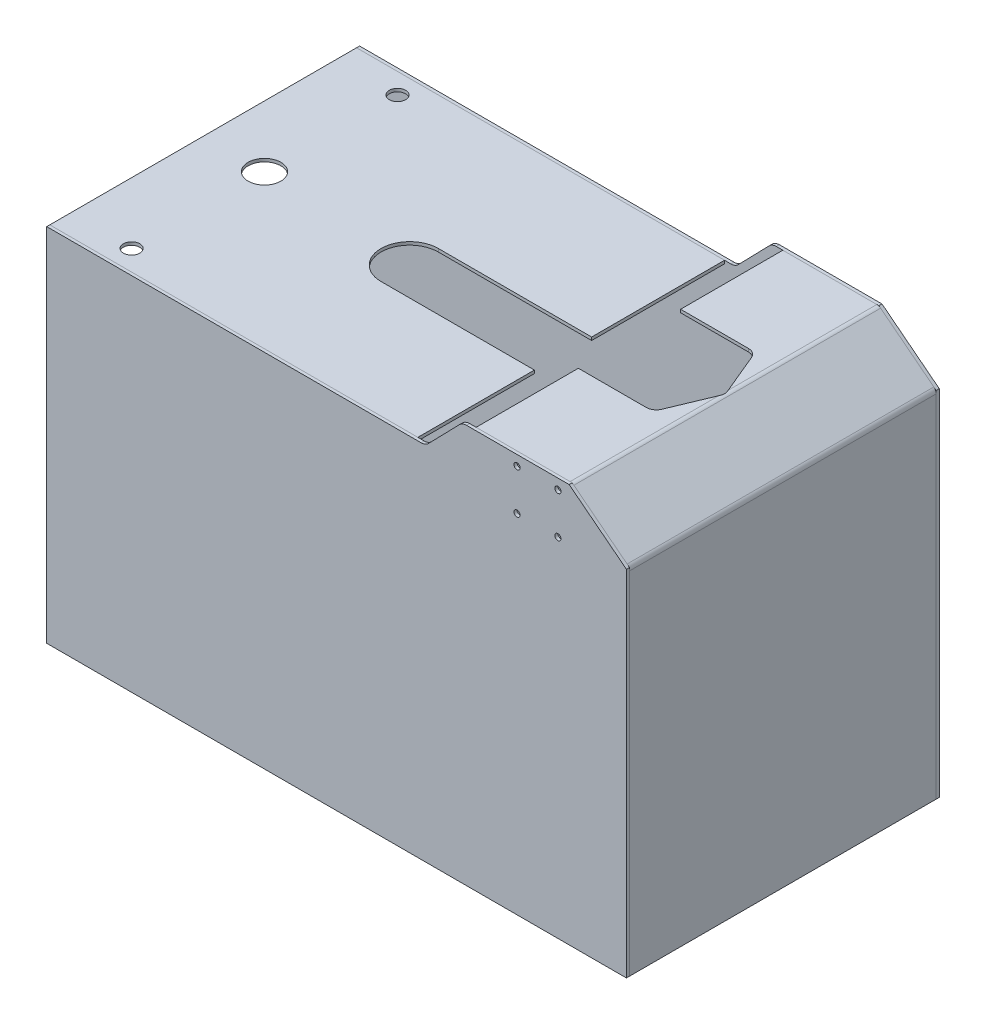
from build123d import *

# Parameters (mm, degrees)
BOSS_EXTRU_1_DEPTH        = 15
BOSS_EXTRU_1_DEPTH_BACK   = 40
ESQUISSE1_R               = 4
ESQUISSE2_W               = 420
ESQUISSE2_H               = 150
BOSS_EXTRU_2_DEPTH        = 16
BOSS_EXTRU_3_DEPTH        = 6
ESQUISSE5_W               = 421.5
ESQUISSE5_H               = 195
BOSS_EXTRU_4_DEPTH        = 1.5
T_LE_DE_BASE_PLI_E1_DEPTH = 150
ESQUISSE11_R              = 1.5
ENL_V_MAT_EXTRU_1_DEPTH   = 330.395279262
ENL_V_MAT_EXTRU_2_DEPTH   = 5
CONG_1_R                  = 5
ESQUISSE13_W              = 180
ESQUISSE13_H              = 1.5
T_LE_DE_BASE_PLI_E2_DEPTH = 150
ENL_V_MAT_EXTRU_4_DEPTH   = 329.70807728
CONG_3_R                  = 5
CHANFREIN1_SIZE           = 28
CHANFREIN1_SIZE2          = 21.875997542
ENL_V_MAT_EXTRU_3_DEPTH   = 1.5
ESQUISSE18_R              = 8
ESQUISSE18_R_2            = 4
ENL_V_MAT_EXTRU_5_DEPTH   = 1.5
ESQUISSE19_W              = 138
ESQUISSE19_H              = 176.5
ENL_V_MAT_EXTRU_6_DEPTH   = 331.087867149


# Sheet-metal steps are written as plain solids
with BuildPart() as part:
    # Esquisse1 → Boss.-Extru.1 (new, two sides: drawn at the far end of the back side and taken through both)
    with BuildSketch(Plane(origin=(0, 0, 0), x_dir=(1, 0, 0), z_dir=(0, 1, 0)).offset(-BOSS_EXTRU_1_DEPTH_BACK)):
        with Locations(Location((0, 0, 0), (0, 0, 270))):
            Circle(ESQUISSE1_R)
    extrude(amount=BOSS_EXTRU_1_DEPTH + BOSS_EXTRU_1_DEPTH_BACK)

    # Esquisse4 → Boss.-Extru.3 (add)
    with BuildSketch(Plane(origin=(0, 15, 0), x_dir=(1, 0, 0), z_dir=(0, 1, 0))):
        Polygon((6.5, 3.75277675), (0, 7.505553499), (-6.5, 3.75277675), (-6.5, -3.75277675), (0, -7.505553499), (6.5, -3.75277675), align=None)
    extrude(amount=BOSS_EXTRU_3_DEPTH)


with BuildPart() as body_2:
    # Esquisse2 → Boss.-Extru.2 (new body)
    with BuildSketch(Plane(origin=(0, 0, 0), x_dir=(1, 0, 0), z_dir=(0, 1, 0))):
        with Locations((-8, 0)):
            Rectangle(ESQUISSE2_W, ESQUISSE2_H)
    extrude(amount=BOSS_EXTRU_2_DEPTH)


with BuildPart() as body_3:
    # Esquisse5 → Boss.-Extru.4 (new body)
    with BuildSketch(Plane.XY.offset(75)):
        with Locations((-7.25, 97.5)):
            Rectangle(ESQUISSE5_W, ESQUISSE5_H)
    extrude(amount=BOSS_EXTRU_4_DEPTH)

    # Esquisse11 → Enlèv. mat.-Extru.1 (cut, through all)
    with BuildSketch(Plane.XY.offset(76.5)):
        with Locations((150, 190)):
            Circle(ESQUISSE11_R)
        with Locations((150, 170)):
            Circle(ESQUISSE11_R)
        with Locations((170, 170)):
            Circle(ESQUISSE11_R)
        with Locations((170, 190)):
            Circle(ESQUISSE11_R)
    extrude(amount=-ENL_V_MAT_EXTRU_1_DEPTH, mode=Mode.SUBTRACT)

    # Esquisse17 → Enlèv. mat.-Extru.4 (cut, through all)
    with BuildSketch(Plane(origin=(0, 0, 75), x_dir=(-1, 0, 0), z_dir=(0, 0, -1))):
        Polygon((-123.25, 195), (-105.25, 176.5), (218, 176.5), (218, 195), align=None)
    extrude(amount=-ENL_V_MAT_EXTRU_4_DEPTH, mode=Mode.SUBTRACT)

    # Congé3
    cong_3_edges = [body_3.edges().sort_by_distance(p)[0] for p in [
        (123.25, 195, 75.75),
        (105.25, 176.5, 75.75),
    ]]
    fillet(cong_3_edges, radius=CONG_3_R)

    # Chanfrein1
    chanfrein1_edges = [body_3.edges().sort_by_distance(p)[0] for p in [
        (203.5, 195, 75.75),
    ]]
    chanfrein1_side = [body_3.faces().sort_by_distance(p)[0] for p in [
        (164.430651216, 195, 75.75),
    ]]
    chamfer(chanfrein1_edges, length=CHANFREIN1_SIZE, length2=CHANFREIN1_SIZE2, reference=chanfrein1_side[0])


with BuildPart() as body_4:
    # Esquisse6 → Tôle de base pliée1 (new body)
    with BuildSketch(Plane(origin=(0, 0, 75), x_dir=(-1, 0, 0), z_dir=(0, 0, -1))):
        with BuildLine():
            Line((-203.5, 0), (-203.5, 171.660804692))
            ThreePointArc((-203.5, 171.660804692), (-203.196382139, 172.975918132), (-202.346984426, 174.024836953))
            Line((-202.346984426, 174.024836953), (-176.314001586, 194.364032261))
            ThreePointArc((-176.314001586, 194.364032261), (-175.443721624, 194.836555727), (-174.46701716, 195))
            Line((-174.46701716, 195), (-128.5, 195))
            Line((-128.5, 195), (-128.5, 193.5))
            Line((-128.5, 193.5), (-174.46701716, 193.5))
            ThreePointArc((-174.46701716, 193.5), (-174.955369392, 193.418277863), (-175.390509373, 193.18201613))
            Line((-175.390509373, 193.18201613), (-201.423492213, 172.842820823))
            ThreePointArc((-201.423492213, 172.842820823), (-201.848191069, 172.318361412), (-202, 171.660804692))
            Line((-202, 171.660804692), (-202, 0))
            Line((-202, 0), (-203.5, 0))
        make_face()
    extrude(amount=T_LE_DE_BASE_PLI_E1_DEPTH)

    # Esquisse12 → Enlèv. mat.-Extru.2 (cut)
    with BuildSketch(Plane(origin=(0, 195, 0), x_dir=(1, 0, 0), z_dir=(0, 1, 0))):
        with BuildLine():
            Line((128.5, 25), (165, 25))
            Line((165, 25), (174.615384615, 1.923076923))
            ThreePointArc((174.615384615, 1.923076923), (175, 0), (174.615384615, -1.923076923))
            Line((174.615384615, -1.923076923), (165, -25))
            Line((165, -25), (128.5, -25))
            Line((128.5, -25), (128.5, 25))
        make_face()
    extrude(amount=-ENL_V_MAT_EXTRU_2_DEPTH, mode=Mode.SUBTRACT)

    # Congé1
    cong_1_edges = [body_4.edges().sort_by_distance(p)[0] for p in [
        (165, 194.25, 25),
        (165, 194.25, -25),
    ]]
    fillet(cong_1_edges, radius=CONG_1_R)


with BuildPart() as body_5:
    # Esquisse13 → Tôle de base pliée2 (new body)
    with BuildSketch(Plane(origin=(0, 0, 75), x_dir=(-1, 0, 0), z_dir=(0, 0, -1))):
        with Locations((-10, 175.75)):
            Rectangle(ESQUISSE13_W, ESQUISSE13_H)
    extrude(amount=T_LE_DE_BASE_PLI_E2_DEPTH)

    # Esquisse16 → Enlèv. mat.-Extru.3 (cut)
    with BuildSketch(Plane(origin=(0, 176.5, 0), x_dir=(1, 0, 0), z_dir=(0, 1, 0))):
        with BuildLine():
            Line((100, 10), (25, 10))
            ThreePointArc((25, 10), (11, -4), (25, -18))
            Line((25, -18), (100, -18))
            Line((100, -18), (100, 10))
        make_face()
    extrude(amount=-ENL_V_MAT_EXTRU_3_DEPTH, mode=Mode.SUBTRACT)

    # Esquisse18 → Enlèv. mat.-Extru.5 (cut)
    with BuildSketch(Plane(origin=(0, 176.5, 0), x_dir=(1, 0, 0), z_dir=(0, 1, 0))):
        with Locations(Location((-50, 0, 0), (0, 0, 270))):
            Circle(ESQUISSE18_R)
        with Locations(Location((-50, -65, 0), (0, 0, 270))):
            Circle(ESQUISSE18_R_2)
        with Locations(Location((-50, 65, 0), (0, 0, 270))):
            Circle(ESQUISSE18_R_2)
    extrude(amount=-ENL_V_MAT_EXTRU_5_DEPTH, mode=Mode.SUBTRACT)


with BuildPart() as body_6:
    # Symétrie1: mirrored copy
    add(body_3.part.mirror(Plane.XY))


with BuildPart() as enl_v_mat_extru_6_tool:
    # Esquisse19 → Enlèv. mat.-Extru.6 (new, through all)
    with BuildSketch(Plane.XY.offset(76.5)):
        with Locations((-149, 88.25)):
            Rectangle(ESQUISSE19_W, ESQUISSE19_H)
    extrude(amount=-ENL_V_MAT_EXTRU_6_DEPTH)


with BuildPart() as body_2_1:
    add(body_2.part)

    # Enlèv. mat.-Extru.6: cut by enl_v_mat_extru_6_tool
    add(enl_v_mat_extru_6_tool.part, mode=Mode.SUBTRACT)


with BuildPart() as body_3_1:
    add(body_3.part)

    # Enlèv. mat.-Extru.6: cut by enl_v_mat_extru_6_tool
    add(enl_v_mat_extru_6_tool.part, mode=Mode.SUBTRACT)


with BuildPart() as body_6_1:
    add(body_6.part)

    # Enlèv. mat.-Extru.6: cut by enl_v_mat_extru_6_tool
    add(enl_v_mat_extru_6_tool.part, mode=Mode.SUBTRACT)


solid = Compound([part.part, body_4.part, body_5.part, body_2_1.part, body_3_1.part, body_6_1.part])
